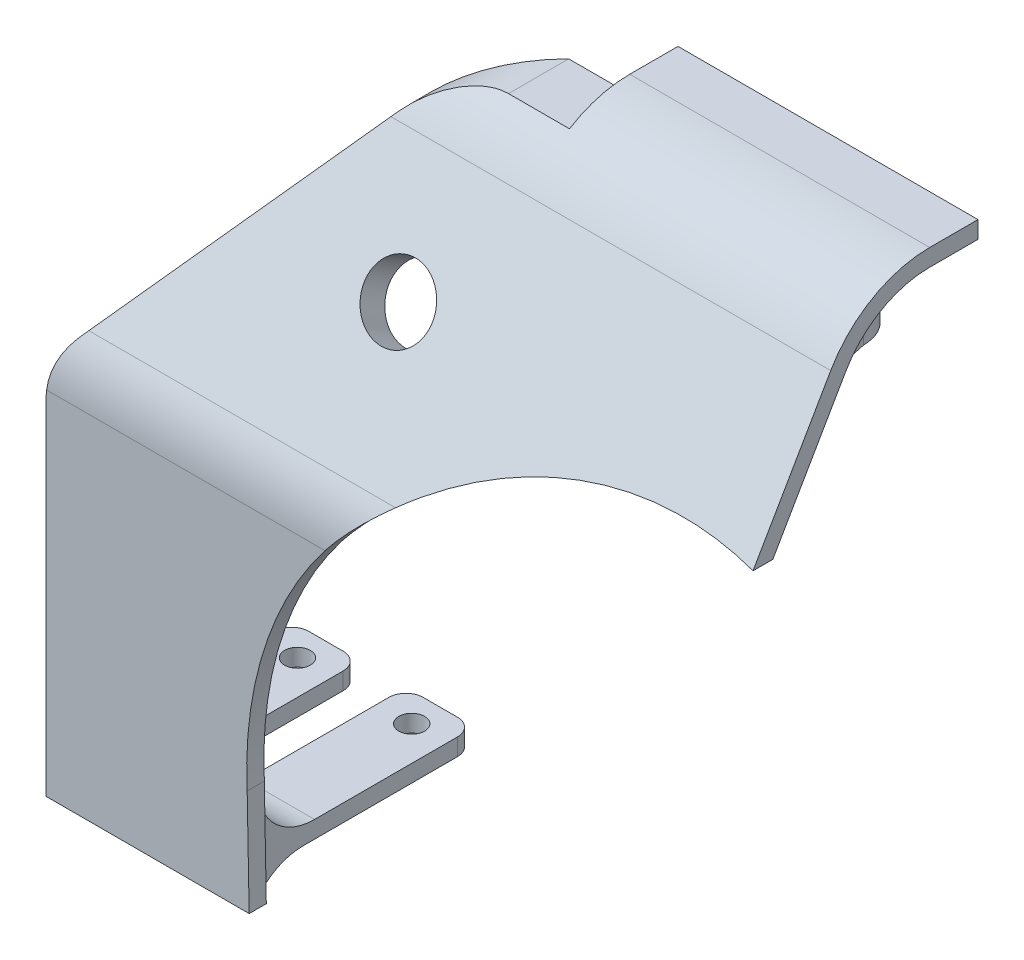
from build123d import *

# Parameters (mm, degrees)
SALIENTE_EXTRUIR1_DEPTH  = 58.05
REDONDEO1_R              = 20
REDONDEO2_R              = 20
REDONDEO3_R              = 17
REDONDEO4_R              = 17
CAVIDAD1_START           = -47
CAVIDAD1_DEPTH           = 51
CROQUIS8_W               = 12
CROQUIS8_H               = 3
SALIENTE_EXTRUIR2_DEPTH  = 38
CROQUIS9_R               = 2.25
CORTAR_EXTRUIR6_DEPTH    = 135.588949923
SALIENTE_EXTRUIR3_REACH  = 146.947
CROQUIS11_W              = 20
CROQUIS11_H              = 3
CROQUIS12_W              = 69.238292886
CROQUIS12_H              = 3
CORTAR_EXTRUIR7_DEPTH    = 1
CROQUIS15_R              = 1.75
CORTAR_EXTRUIR10_DEPTH   = 5
REDONDEO5_R              = 7
REDONDEO6_R              = 3
CROQUIS18_R              = 6
CORTAR_EXTRUIR12_DEPTH   = 146.081609054
CROQUIS19_R              = 8.25
CROQUIS19_R_2            = 6
SALIENTE_EXTRUIR4_DEPTH  = 2
CROQUIS16_R              = 65
CORTAR_EXTRUIR11_DEPTH   = 145.946782753
SALIENTE_EXTRUIR5_DEPTH  = 3
NERVIO8_START            = -1.125
NERVIO8_DEPTH            = 2.25
MATRIZC2_COUNT           = 6
REDONDEO6_OF_SIMETR_A1_R = 3
REDONDEO7_R              = 10
REDONDEO8_R              = 10
REDONDEO9_R              = 6
CORTAR_EXTRUIR14_DEPTH   = 145.946782753
REDONDEO10_R             = 5


with BuildPart() as part:
    # Croquis1 → Saliente-Extruir1 (new, symmetric)
    with BuildSketch(Plane(origin=(0, 0, 0), x_dir=(0, 0, -1), z_dir=(1, 0, 0))):
        Polygon((0, 0), (0, 67.196152423), (28.732050808, 116.961524227), (47, 116.961524227), (47, 119.961524227), (27, 119.961524227), (-3, 68), (-3, 0), align=None)
    extrude(amount=SALIENTE_EXTRUIR1_DEPTH, both=True)

    # Redondeo1
    redondeo1_edges = [part.edges().sort_by_distance(p)[0] for p in [
        (0, 68, 3),
    ]]
    fillet(redondeo1_edges, radius=REDONDEO1_R)

    # Redondeo2
    redondeo2_edges = [part.edges().sort_by_distance(p)[0] for p in [
        (0, 119.961524227, -27),
    ]]
    fillet(redondeo2_edges, radius=REDONDEO2_R)

    # Redondeo3
    redondeo3_edges = [part.edges().sort_by_distance(p)[0] for p in [
        (0, 116.961524227, -28.732050808),
    ]]
    fillet(redondeo3_edges, radius=REDONDEO3_R)

    # Redondeo4
    redondeo4_edges = [part.edges().sort_by_distance(p)[0] for p in [
        (0, 67.196152423, 0),
    ]]
    fillet(redondeo4_edges, radius=REDONDEO4_R)

    # Cavidad1: read off the stored shape, not the designer's step
    # Cavidad1 outline → Cavidad1 (cut)
    with BuildSketch(Plane.XY.offset(CAVIDAD1_START)):
        with BuildLine():
            Line((58.05, 0), (58.05, 119.961524227))
            Line((58.05, 119.961524227), (-5.55, 119.961524227))
            Line((-5.55, 119.961524227), (-5.55, 116.961524227))
            Line((-5.55, 116.961524227), (5.123846837, 116.961524227))
            ThreePointArc((5.123846837, 116.961524227), (12.308357287, 115.368756607), (18.14660237, 110.888913592))
            Line((18.14660237, 110.888913592), (51.073651347, 71.647984679))
            ThreePointArc((51.073651347, 71.647984679), (54.025670368, 66.534937751), (55.050895814, 60.720595315))
            Line((55.050895814, 60.720595315), (55.050895814, 0))
            Line((55.050895814, 0), (58.05, 0))
        make_face()
    extrude(amount=CAVIDAD1_DEPTH, mode=Mode.SUBTRACT)

    # Croquis8 → Saliente-Extruir2 (add)
    with BuildSketch(Plane(origin=(0, 0, 0), x_dir=(-1, 0, 0), z_dir=(0, 0, -1))):
        with Locations((-47.050895814, 6.5)):
            Rectangle(CROQUIS8_W, CROQUIS8_H)
    saliente_extruir2 = extrude(amount=SALIENTE_EXTRUIR2_DEPTH)

    # Croquis9 → Cortar-Extruir6 (cut, through all)
    with BuildSketch(Plane(origin=(0, 8, 0), x_dir=(1, 0, 0), z_dir=(0, 1, 0))):
        with Locations(Location((47.050895814, 33, 0), (0, 0, 180))):
            Circle(CROQUIS9_R)
    cortar_extruir6 = extrude(amount=-CORTAR_EXTRUIR6_DEPTH, mode=Mode.SUBTRACT)

    # Saliente-Extruir3: up to this plane
    saliente_extruir3_end = Plane(origin=(58.05, 67.196152423, 0), z_dir=(0, 0.49999999999999767, 0.86602540378444))
    # Croquis11 → Saliente-Extruir3 (add, up to the surface)
    with BuildSketch(Plane(origin=(0, 0, -54), x_dir=(-1, 0, 0), z_dir=(0, 0, -1)), mode=Mode.PRIVATE) as saliente_extruir3_sk1:
        with Locations((28.05, 92.461524227)):
            Rectangle(CROQUIS11_W, CROQUIS11_H)
    saliente_extruir3_tool1 = split(extrude(saliente_extruir3_sk1.sketch, amount=-SALIENTE_EXTRUIR3_REACH, mode=Mode.PRIVATE), bisect_by=saliente_extruir3_end, keep=Keep.BOTH, mode=Mode.PRIVATE)
    add(saliente_extruir3_tool1.solids().sort_by_distance((-28.05, 92.461524, -54))[0])

    # Croquis12 → Cortar-Extruir7 (cut)
    with BuildSketch(Plane.XZ):
        with Locations((20.431749371, 1.5)):
            Rectangle(CROQUIS12_W, CROQUIS12_H)
    extrude(amount=-CORTAR_EXTRUIR7_DEPTH, mode=Mode.SUBTRACT)

    # Croquis15 → Cortar-Extruir10 (cut)
    with BuildSketch(Plane.XZ.offset(-90.961524227)):
        with Locations(Location((-28.049104186, -49.5, 0), (0, 0, 270))):
            Circle(CROQUIS15_R)
    extrude(amount=-CORTAR_EXTRUIR10_DEPTH, mode=Mode.SUBTRACT)

    # Redondeo5
    redondeo5_edges = [part.edges().sort_by_distance(p)[0] for p in [
        (-18.05, 92.461524227, -54),
        (-38.05, 92.461524227, -54),
    ]]
    fillet(redondeo5_edges, radius=REDONDEO5_R)

    # Redondeo6
    redondeo6_edges = [part.edges().sort_by_distance(p)[0] for p in [
        (53.050895814, 6.5, -38),
        (41.050895814, 6.5, -38),
    ]]
    fillet(redondeo6_edges, radius=REDONDEO6_R)

    # Croquis18 → Cortar-Extruir12 (cut, through all)
    with BuildSketch(Plane(origin=(0, 18.299038106, 31.694863729), x_dir=(1, 0, 0), z_dir=(0, 0.4999999999999976, 0.86602540378444))):
        with Locations(Location((7.567578046, 85.748711306, 0), (0, 0, 270))):
            Circle(CROQUIS18_R)
    extrude(amount=-CORTAR_EXTRUIR12_DEPTH, mode=Mode.SUBTRACT)

    # Croquis19 → Saliente-Extruir4 (add)
    with BuildSketch(Plane(origin=(0, 16.799038106, 29.096787517), x_dir=(-1, 0, 0), z_dir=(0, -0.4999999999999977, -0.8660254037844399))):
        with Locations(Location((-7.567578046, 85.748711306, 0), (0, 0, 270))):
            Circle(CROQUIS19_R)
        with Locations(Location((-7.567578046, 85.748711306, 0), (0, 0, 270))):
            Circle(CROQUIS19_R_2, mode=Mode.SUBTRACT)
    extrude(amount=SALIENTE_EXTRUIR4_DEPTH)

    # Croquis16 → Cortar-Extruir11 (cut, through all)
    with BuildSketch(Plane.XY.offset(3)):
        with Locations((-45.071920691, 22.721524227)):
            Circle(CROQUIS16_R)
    extrude(amount=-CORTAR_EXTRUIR11_DEPTH, mode=Mode.SUBTRACT)

    # Croquis25 → Saliente-Extruir5 (add)
    with BuildSketch(Plane.XZ.offset(-90.961524227)):
        Polygon((-38.05, -13.720943809), (-45.254421175, -13.720943809), (-38.05, -47), align=None)
        Polygon((-10.845578825, -13.720943809), (-18.05, -47), (-18.05, -13.720943809), align=None)
    extrude(amount=-SALIENTE_EXTRUIR5_DEPTH)

    # Nervio8: read off the stored shape, not the designer's step
    # Nervio8 outline → Nervio8 (add)
    with BuildSketch(Plane(origin=(46.658144676, 40.407138583, -23.329072338), x_dir=(-0.7071067811865435, 0.6123724356957997, -0.353553390593273), z_dir=(-0.7071067811865517, -0.612372435695792, 0.35355339059327007)).offset(NERVIO8_START)):
        Polygon((47.10947397, -31.598076211), (47.032409489, -31.598076211), (43.032409489, -33.598076211), (47.10947397, -33.598076211), align=None)
    nervio8 = extrude(amount=NERVIO8_DEPTH)

    # MatrizC2: Nervio8 ×6 about axis
    matrizc2_axis = Axis((7.567578046, 74.260562333, -42.874355653), (0, -0.49999999999999767, -0.86602540378444))
    for i in range(1, MATRIZC2_COUNT):
        add(nervio8.rotate(matrizc2_axis, i * 360 / MATRIZC2_COUNT))

    # Simetría1: Saliente-Extruir2, Cortar-Extruir6 across plane
    add(saliente_extruir2.mirror(Plane(origin=(37.050895814, 0, 0), x_dir=(0, 0, 1), z_dir=(1, 0, 0))))
    add(cortar_extruir6.mirror(Plane(origin=(37.050895814, 0, 0), x_dir=(0, 0, 1), z_dir=(1, 0, 0))), mode=Mode.SUBTRACT)

    # Redondeo6 of Simetría1
    redondeo6_of_simetr_a1_edges = [part.edges().sort_by_distance(p)[0] for p in [
        (21.050895814, 6.5, -38),
        (33.050895814, 6.5, -38),
    ]]
    fillet(redondeo6_of_simetr_a1_edges, radius=REDONDEO6_OF_SIMETR_A1_R)

    # Redondeo7
    # the kernel refuses this fillet: 10 mm, written as the material it adds along each edge
    with BuildSketch(Plane(origin=(21.050895814, 5, 0), x_dir=(0, -1, 0), z_dir=(1, 0, 0))) as redondeo7_piece_1_section:
        with BuildLine():
            CenterArc((10, 8), REDONDEO7_R, 180, 53.130102354)
            Line((0, 8), (-0.2, 8))
            Line((-0.2, 8), (-0.2, 0))
            Line((-0.2, 0), (0, -0.2))
            ThreePointArc((0, -0.2), (2, -0.2), (3.88, -0.16))
            Line((3.88, -0.16), (4, 0))
        make_face()
    redondeo7_piece_1 = extrude(amount=32, mode=Mode.PRIVATE)
    redondeo7_piece_1 = split(redondeo7_piece_1, bisect_by=Plane(origin=(33.050895814, 5, 0), z_dir=(-1, 0, 0)), keep=Keep.TOP, mode=Mode.PRIVATE)
    add(redondeo7_piece_1)
    with BuildSketch(Plane(origin=(41.050895814, 5, 0), x_dir=(0, -1, 0), z_dir=(1, 0, 0))) as redondeo7_piece_2:
        with BuildLine():
            CenterArc((10, 8), REDONDEO7_R, 180, 53.130102354)
            Line((0, 8), (-0.2, 8))
            Line((-0.2, 8), (-0.2, 0))
            Line((-0.2, 0), (0, -0.2))
            ThreePointArc((0, -0.2), (2, -0.2), (3.88, -0.16))
            Line((3.88, -0.16), (4, 0))
        make_face()
    extrude(amount=12)
    with BuildSketch(Plane(origin=(53.050895814, 5, 0), x_dir=(0, -1, 0), z_dir=(-1, 0, 0))) as redondeo7_piece_3_section:
        with BuildLine():
            CenterArc((10, -8), REDONDEO7_R, 126.869897646, 53.130102354)
            Line((0, -8), (-0.2, -8))
            Line((-0.2, -8), (-0.2, 0))
            Line((-0.2, 0), (0, 0.2))
            ThreePointArc((0, 0.2), (2, 0.2), (3.88, 0.16))
            Line((3.88, 0.16), (4, 0))
        make_face()
    redondeo7_piece_3 = extrude(amount=32, mode=Mode.PRIVATE)
    redondeo7_piece_3 = split(redondeo7_piece_3, bisect_by=Plane(origin=(41.050895814, 5, 0), z_dir=(1, 0, 0)), keep=Keep.TOP, mode=Mode.PRIVATE)
    add(redondeo7_piece_3)
    with BuildSketch(Plane(origin=(33.050895814, 5, 0), x_dir=(0, -1, 0), z_dir=(-1, 0, 0))) as redondeo7_piece_4:
        with BuildLine():
            CenterArc((10, -8), REDONDEO7_R, 126.869897646, 53.130102354)
            Line((0, -8), (-0.2, -8))
            Line((-0.2, -8), (-0.2, 0))
            Line((-0.2, 0), (0, 0.2))
            ThreePointArc((0, 0.2), (2, 0.2), (3.88, 0.16))
            Line((3.88, 0.16), (4, 0))
        make_face()
    extrude(amount=12)

    # Redondeo8
    redondeo8_edges = [part.edges().sort_by_distance(p)[0] for p in [
        (47.050895814, 8, 0),
        (27.050895814, 8, 0),
    ]]
    fillet(redondeo8_edges, radius=REDONDEO8_R)

    # Redondeo9
    redondeo9_edges = [part.edges().sort_by_distance(p)[0] for p in [
        (-28.05, 93.961524227, -15.452994616),
    ]]
    fillet(redondeo9_edges, radius=REDONDEO9_R)

    # Croquis31 → Cortar-Extruir14 (cut, through all)
    with BuildSketch(Plane.XY.offset(3)):
        with BuildLine():
            Line((16.191244305, 1), (19.497703143, 1))
            Line((19.497703143, 1), (19.844268253, 19.421764692))
            ThreePointArc((19.844268253, 19.421764692), (18.686590065, 10.078253042), (16.191244305, 1))
        make_face()
    extrude(amount=-CORTAR_EXTRUIR14_DEPTH, mode=Mode.SUBTRACT)

    # Redondeo10
    redondeo10_edges = [part.edges().sort_by_distance(p)[0] for p in [
        (-28.05, 90.961524227, -13.720943809),
    ]]
    fillet(redondeo10_edges, radius=REDONDEO10_R)


with BuildPart() as body_2:
    # Simetría2: mirrored copy
    add(part.part.mirror(Plane(origin=(-58.05, 0, 0), x_dir=(0, 0, 1), z_dir=(1, 0, 0))))


solid = body_2.part
